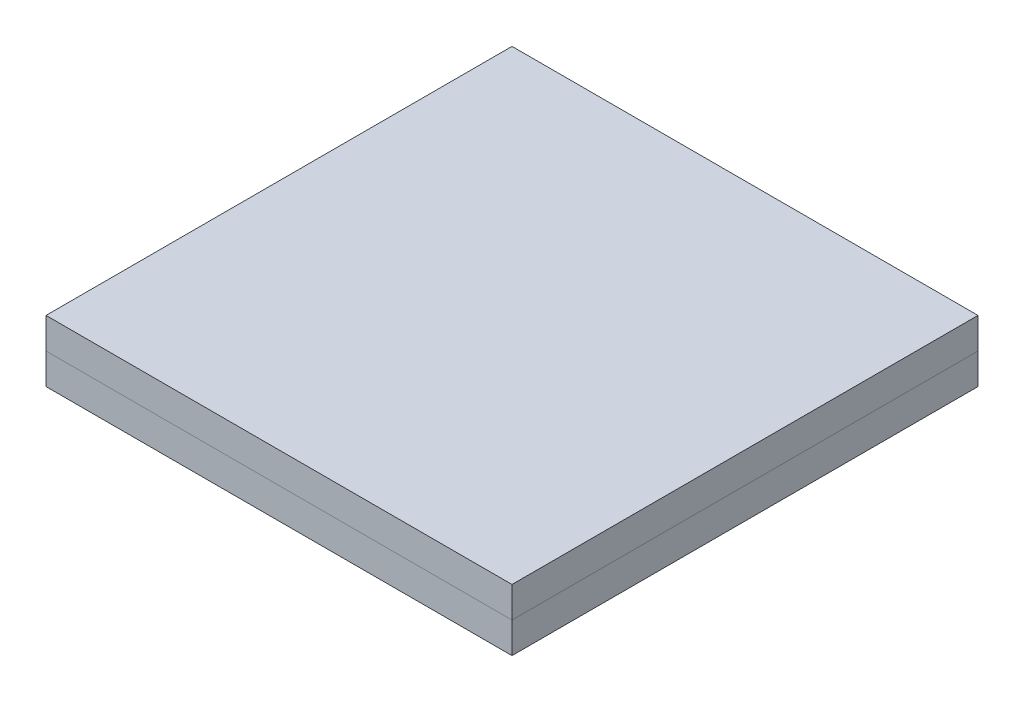
from build123d import *

# Parameters (mm, degrees)
SKETCH1_W           = 24
SKETCH1_H           = 24
BOSS_EXTRUDE1_DEPTH = 3.175


with BuildPart() as part:
    # Sketch1 → Boss-Extrude1 (new body)
    with BuildSketch(Plane(origin=(0, 0, 0), x_dir=(1, 0, 0), z_dir=(0, 1, 0))):
        Rectangle(SKETCH1_W, SKETCH1_H)
    extrude(amount=BOSS_EXTRUDE1_DEPTH)


with BuildPart() as body_2:
    # Split1: the piece on the far side of the plane
    add(part.part)
    split(bisect_by=Plane.ZX.offset(1.5875), keep=Keep.BOTTOM)


with BuildPart() as part_1:
    add(part.part)

    # Split1
    split(bisect_by=Plane.ZX.offset(1.5875), keep=Keep.TOP)


solid = Compound([body_2.part, part_1.part])
